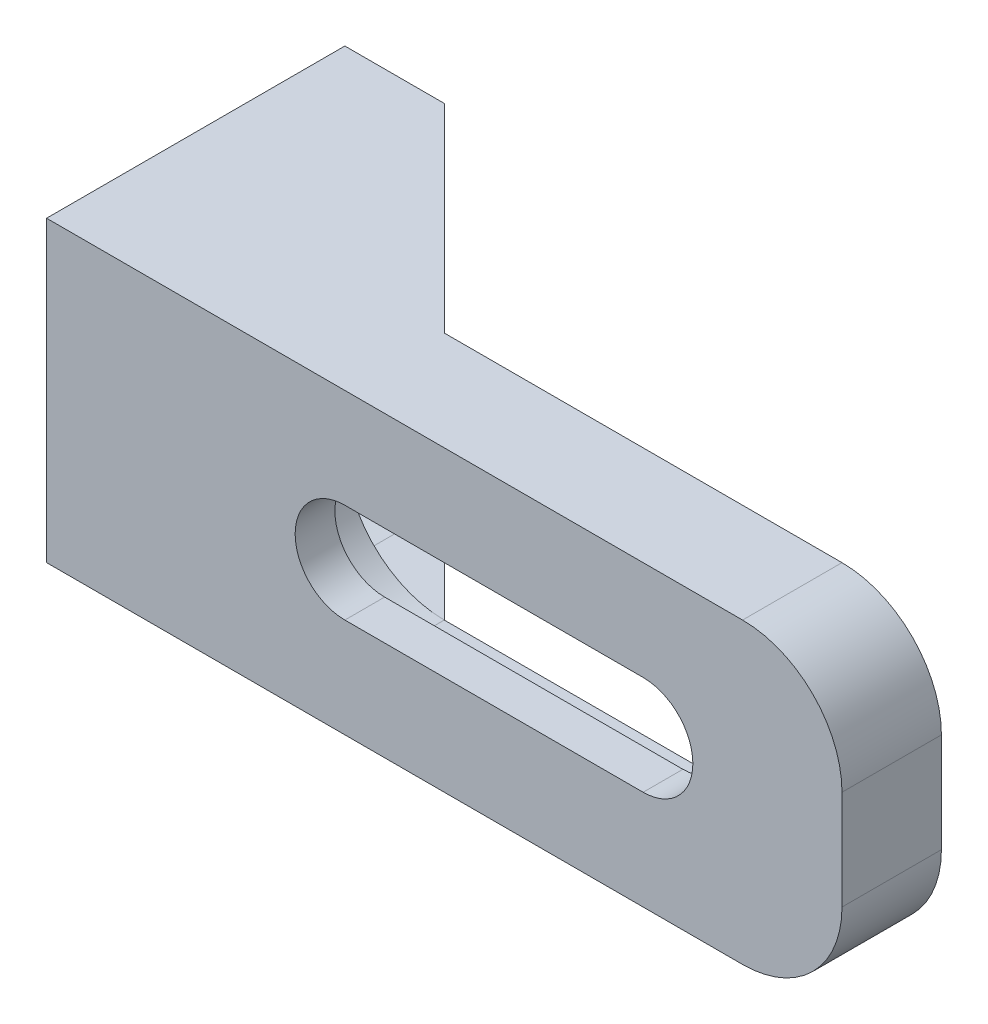
from build123d import *
from build123d.topology import SkipClean

# Parameters (mm, degrees)
EXTRUDE_1_DEPTH     = 2
EXTRUDE_2_DEPTH     = 5
EXTRUDE_3_DEPTH     = 15
EXTRUDE_4_DEPTH     = 15
CUT_EXTRUDE_1_DEPTH = 15
CUT_EXTRUDE_2_DEPTH = 15
CUT_EXTRUDE_3_DEPTH = 15
EXTRUDE_9_DEPTH     = 2
EXTRUDE_10_DEPTH    = 5


with BuildPart() as part:
    # Эскиз1 → Бобышка-Вытянуть1 (new body)
    with BuildSketch(Plane.XY):
        with BuildLine():
            Line((15, 7.5), (-20, 7.5))
            Line((-20, 7.5), (-20, -7.5))
            Line((-20, -7.5), (15, -7.5))
            ThreePointArc((15, -7.5), (18.535533906, -6.035533906), (20, -2.5))
            Line((20, -2.5), (20, 2.5))
            ThreePointArc((20, 2.5), (18.535533906, 6.035533906), (15, 7.5))
        make_face()
        with BuildLine():
            Line((10, -2.5), (-5, -2.5))
            ThreePointArc((-5, -2.5), (-7.5, 0), (-5, 2.5))
            Line((-5, 2.5), (10, 2.5))
            ThreePointArc((10, 2.5), (12.5, 0), (10, -2.5))
        make_face(mode=Mode.SUBTRACT)
    extrude(amount=-EXTRUDE_1_DEPTH)

    # Эскиз1<3> → Бобышка-Вытянуть2 (add)
    with BuildSketch(Plane.XY):
        with BuildLine():
            Line((15, 7.5), (-20, 7.5))
            Line((-20, 7.5), (-20, -7.5))
            Line((-20, -7.5), (15, -7.5))
            ThreePointArc((15, -7.5), (18.535533906, -6.035533906), (20, -2.5))
            Line((20, -2.5), (20, 2.5))
            ThreePointArc((20, 2.5), (18.535533906, 6.035533906), (15, 7.5))
        make_face()
        with BuildLine():
            ThreePointArc((-5, -5), (-10, 0), (-5, 5))
            Line((-5, 5), (10, 5))
            ThreePointArc((10, 5), (15, 0), (10, -5))
            Line((10, -5), (-5, -5))
        make_face(mode=Mode.SUBTRACT)
    extrude(amount=-EXTRUDE_2_DEPTH)

    # Эскиз1<4> → Бобышка-Вытянуть3 (add)
    with BuildSketch(Plane.XY):
        Polygon((-15, 0), (-15, 7.5), (-20, 7.5), (-20, -7.5), (-15, -7.5), align=None)
    extrude(amount=-EXTRUDE_3_DEPTH)

    # Эскиз2 → Бобышка-Вытянуть4 (add)
    with BuildSketch(Plane(origin=(0, 7.5, 0), x_dir=(1, 0, 0), z_dir=(0, 1, 0))):
        Polygon((-15, 15), (-5, 5), (-15, 5), align=None)
    extrude(amount=-EXTRUDE_4_DEPTH)

    # Эскиз1<5> → Вырез-Вытянуть1 (cut)
    with BuildSketch(Plane.XY):
        with BuildLine():
            Line((10, 2.5), (-5, 2.5))
            ThreePointArc((-5, 2.5), (-7.5, 0), (-5, -2.5))
            Line((-5, -2.5), (10, -2.5))
            ThreePointArc((10, -2.5), (12.5, 0), (10, 2.5))
        make_face()
    extrude(amount=-CUT_EXTRUDE_1_DEPTH, mode=Mode.SUBTRACT)

    # Эскиз1<6> → Вырез-Вытянуть2 (cut)
    with SkipClean():  # the faces are left unmerged after this step: merging them gives an invalid solid
        with BuildSketch(Plane.XY):
            with BuildLine():
                Line((10, 5), (-5, 5))
                ThreePointArc((-5, 5), (-10, 0), (-5, -5))
                Line((-5, -5), (10, -5))
                ThreePointArc((10, -5), (15, 0), (10, 5))
            make_face()
            with BuildLine():
                ThreePointArc((-5, -2.5), (-7.5, 0), (-5, 2.5))
                Line((-5, 2.5), (10, 2.5))
                ThreePointArc((10, 2.5), (12.5, 0), (10, -2.5))
                Line((10, -2.5), (-5, -2.5))
            make_face(mode=Mode.SUBTRACT)
        extrude(amount=-CUT_EXTRUDE_2_DEPTH, mode=Mode.SUBTRACT)

    # Эскиз1<7> → Вырез-Вытянуть3 (cut)
    with BuildSketch(Plane.XY):
        with BuildLine():
            ThreePointArc((-10, 5), (-13.535533906, 3.535533906), (-15, 0))
            ThreePointArc((-15, 0), (-13.535533906, -3.535533906), (-10, -5))
            Line((-10, -5), (-5, -5))
            ThreePointArc((-5, -5), (-10, 0), (-5, 5))
            Line((-5, 5), (-10, 5))
        make_face()
    extrude(amount=-CUT_EXTRUDE_3_DEPTH, mode=Mode.SUBTRACT)

    # Эскиз1<12> → Бобышка-Вытянуть9 (add)
    with BuildSketch(Plane.XY):
        with BuildLine():
            ThreePointArc((-10, 5), (-15, 0), (-10, -5))
            Line((-10, -5), (10, -5))
            ThreePointArc((10, -5), (15, 0), (10, 5))
            Line((10, 5), (-10, 5))
        make_face()
        with BuildLine():
            Line((-5, 2.5), (10, 2.5))
            ThreePointArc((10, 2.5), (12.5, 0), (10, -2.5))
            Line((10, -2.5), (-5, -2.5))
            ThreePointArc((-5, -2.5), (-7.5, 0), (-5, 2.5))
        make_face(mode=Mode.SUBTRACT)
    extrude(amount=-EXTRUDE_9_DEPTH)

    # Эскиз1<13> → Бобышка-Вытянуть10 (add)
    with BuildSketch(Plane.XY):
        with BuildLine():
            ThreePointArc((-10, 5), (-13.535533906, 3.535533906), (-15, 0))
            ThreePointArc((-15, 0), (-13.535533906, -3.535533906), (-10, -5))
            Line((-10, -5), (-5, -5))
            ThreePointArc((-5, -5), (-10, 0), (-5, 5))
            Line((-5, 5), (-10, 5))
        make_face()
    extrude(amount=-EXTRUDE_10_DEPTH)


solid = part.part
